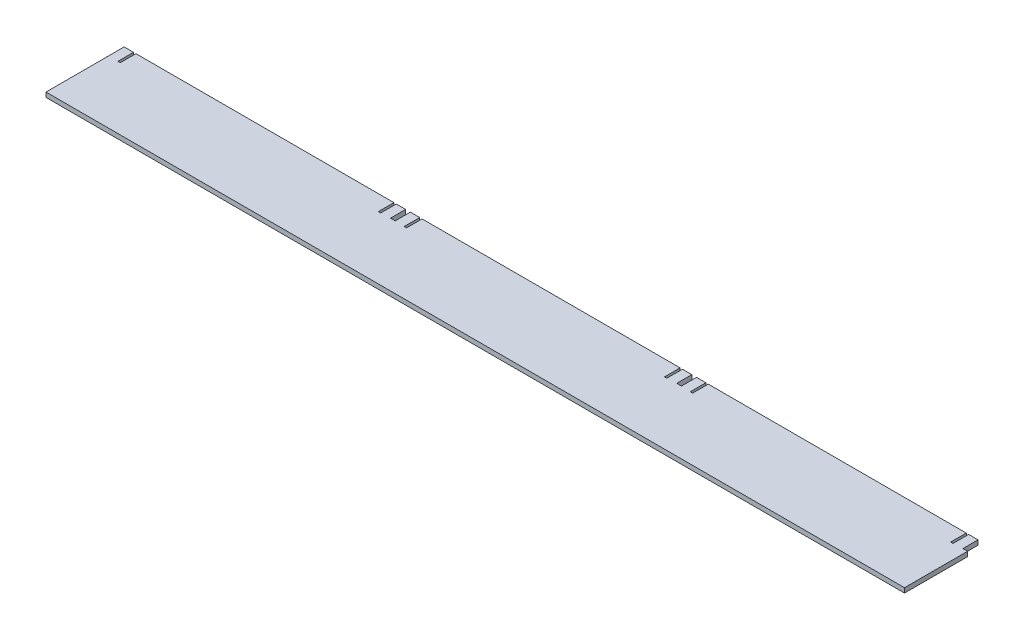
from build123d import *

# Parameters (mm, degrees)
BOSS_EXTRUDE1_DEPTH = 1.5
SKETCH2_W           = 3
SKETCH2_H           = 40.331406252
BOSS_EXTRUDE2_DEPTH = 1.5
LPATTERN2_COUNT     = 3
LPATTERN2_PITCH     = 183


with BuildPart() as part:
    # Sketch1 → Boss-Extrude1 (new, symmetric)
    with BuildSketch(Plane(origin=(0, 0, 0), x_dir=(1, 0, 0), z_dir=(0, 1, 0))):
        Polygon((-84, 25), (-84, 15), (-82.5, 15), (-82.5, 25), (82.5, 25), (82.5, 15), (84, 15), (84, 25), (90, 25), (90, -25), (-90, -25), (-90, 25), align=None)
    boss_extrude1 = extrude(amount=BOSS_EXTRUDE1_DEPTH, both=True)

    # Sketch2 → Boss-Extrude2 (add, symmetric)
    with BuildSketch(Plane(origin=(0, 0, 0), x_dir=(1, 0, 0), z_dir=(0, 1, 0))):
        with Locations((91.5, -4.834296874)):
            Rectangle(SKETCH2_W, SKETCH2_H)
    boss_extrude2 = extrude(amount=BOSS_EXTRUDE2_DEPTH, both=True)

    # LPattern2: Boss-Extrude1, Boss-Extrude2 ×3
    with Locations(*[(i * LPATTERN2_PITCH, 0, 0) for i in range(1, LPATTERN2_COUNT)]):
        add(boss_extrude1)
        add(boss_extrude2)


solid = part.part
